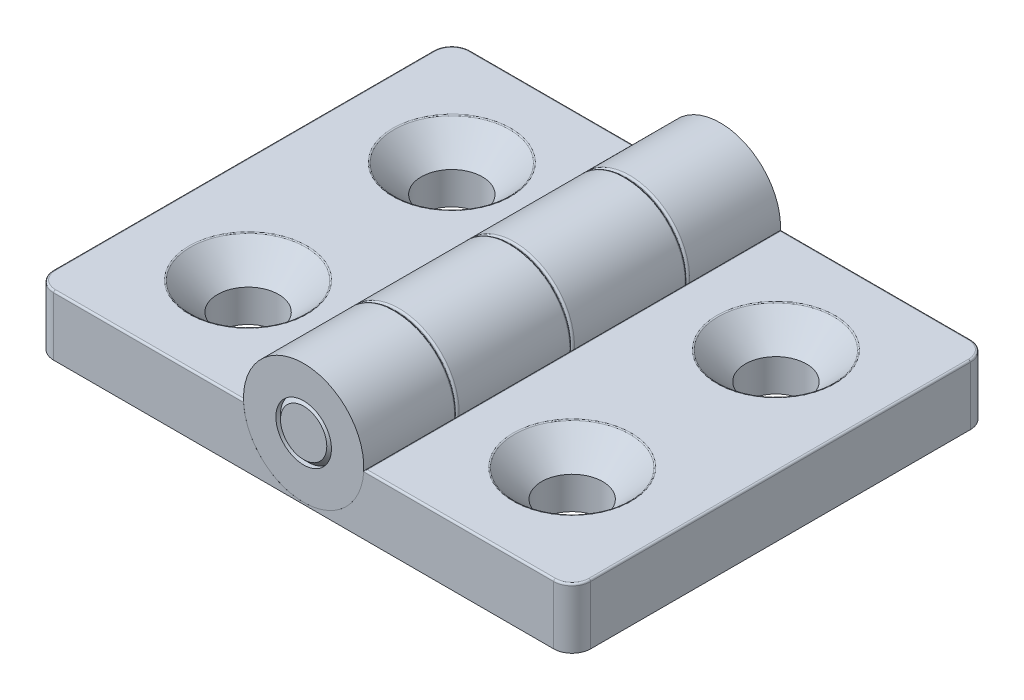
from build123d import *

# Parameters (mm, degrees)
SKETCH_1_R                  = 6.5
SKETCH_1_R_2                = 3
EXTRUDE_1_DEPTH             = 22.5
SKETCH_2_R                  = 3
EXTRUDE_2_DEPTH             = 22.5
CHAMFER_1_SIZE              = 0.5
SKETCH_3_W                  = 2.520053464
SKETCH_3_H                  = 0.1
SKETCH_3_W_2                = 2.303108133
FILLET_1_R                  = 0.2
EXTRUDE_6_DEPTH             = 45
HOLE_WIZARD_M6_1_AT_2_COUNT = 2
HOLE_WIZARD_M6_1_AT_2_PITCH = 35
HOLE_WIZARD_M6_1_AT_3_COUNT = 2
HOLE_WIZARD_M6_1_AT_3_PITCH = 22
HOLE_WIZARD_M6_1_AT_4_COUNT = 2
HOLE_WIZARD_M6_1_AT_4_PITCH = 41.340053217
FILLET_2_R                  = 0.2
FILLET_3_R                  = 2
CHAMFER_2_SIZE              = 0.5


with BuildPart() as part:
    # 草图1 → 凸台-拉伸1 (new, symmetric)
    with BuildSketch(Plane.XY):
        with Locations(Location((0, 0, 0), (0, 0, 180))):
            Circle(SKETCH_1_R)
        with Locations(Location((0, 0, 0), (0, 0, 180))):
            Circle(SKETCH_1_R_2, mode=Mode.SUBTRACT)
    extrude(amount=EXTRUDE_1_DEPTH, both=True)

    # 草图3 → 切除-旋转1 (revolve, cut)
    with BuildSketch(Plane(origin=(0, 0, 0), x_dir=(1, 0, 0), z_dir=(0, 1, 0)), mode=Mode.PRIVATE) as cut_revolve_1_sk:
        with Locations((5.937760795, 12.45)):
            Rectangle(SKETCH_3_W, SKETCH_3_H)
        with Locations((5.937760795, 0)):
            Rectangle(SKETCH_3_W, SKETCH_3_H)
        with Locations((6.04623346, -12.45)):
            Rectangle(SKETCH_3_W_2, SKETCH_3_H)
    revolve(cut_revolve_1_sk.sketch.rotate(Axis((0, 0, 22.5), (0, 0, -1)), 180), axis=Axis((0, 0, 22.5), (0, 0, -1)), mode=Mode.SUBTRACT)

    # 圆角1
    fillet_1_edges = [part.edges().sort_by_distance(p)[0] for p in [
        (6.5, 0, -12.4),
        (6.5, 0, -12.5),
        (6.5, 0, 0.05),
        (6.5, 0, -0.05),
        (6.5, 0, 12.5),
        (6.5, 0, 12.4),
    ]]
    fillet(fillet_1_edges, radius=FILLET_1_R)


with BuildPart() as body_2:
    # 草图2 → 凸台-拉伸2 (new, symmetric)
    with BuildSketch(Plane.XY):
        with Locations(Location((0, 0, 0), (0, 0, 180))):
            Circle(SKETCH_2_R)
    extrude(amount=EXTRUDE_2_DEPTH, both=True)

    # 倒角1
    chamfer_1_edges = [body_2.edges().sort_by_distance(p)[0] for p in [
        (3, 0, 22.5),
    ]]
    chamfer(chamfer_1_edges, length=CHAMFER_1_SIZE)

    # 倒角2
    chamfer_2_edges = [body_2.edges().sort_by_distance(p)[0] for p in [
        (3, 0, -22.5),
    ]]
    chamfer(chamfer_2_edges, length=CHAMFER_2_SIZE)


with BuildPart() as body_3:
    # 草图5 → 凸台-拉伸6 (new body)
    with BuildSketch(Plane(origin=(0, 0, -22.5), x_dir=(-1, 0, 0), z_dir=(0, 0, -1))):
        with BuildLine():
            Line((6.496922348, -0.2), (29, -0.2))
            Line((29, -0.2), (29, -6.7))
            Line((29, -6.7), (-29, -6.7))
            Line((-29, -6.7), (-29, -0.2))
            Line((-29, -0.2), (-6.496922348, -0.2))
            ThreePointArc((-6.496922348, -0.2), (0, -6.5), (6.496922348, -0.2))
        make_face()
    extrude(amount=-EXTRUDE_6_DEPTH)

    # 草图6 → M6 平头机械螺钉的锥形沉头孔1 (revolve, cut)
    with BuildSketch(Plane(origin=(-17.5, -0.2, -11), x_dir=(0, 0, 1), z_dir=(1, 0, 0))):
        Polygon((0, 0), (0, 6.5), (3.3, 6.5), (3.3, 3), (6.3, 0), align=None)
    hole_wizard_m6_1 = revolve(axis=Axis((-17.5, 6.15, -11), (0, -1, 0)), mode=Mode.SUBTRACT)

    # M6 平头机械螺钉的锥形沉头孔1 at 2: M6 平头机械螺钉的锥形沉头孔1 ×2
    with Locations(*[(i * HOLE_WIZARD_M6_1_AT_2_PITCH, 0, 0) for i in range(1, HOLE_WIZARD_M6_1_AT_2_COUNT)]):
        add(hole_wizard_m6_1, mode=Mode.SUBTRACT)

    # M6 平头机械螺钉的锥形沉头孔1 at 3: M6 平头机械螺钉的锥形沉头孔1 ×2
    with Locations(*[(0, 0, i * HOLE_WIZARD_M6_1_AT_3_PITCH) for i in range(1, HOLE_WIZARD_M6_1_AT_3_COUNT)]):
        add(hole_wizard_m6_1, mode=Mode.SUBTRACT)

    # M6 平头机械螺钉的锥形沉头孔1 at 4: M6 平头机械螺钉的锥形沉头孔1 ×2
    with Locations(*[Vector(0.8466365492110047, 0, 0.5321715452183459) * (i * HOLE_WIZARD_M6_1_AT_4_PITCH) for i in range(1, HOLE_WIZARD_M6_1_AT_4_COUNT)]):
        add(hole_wizard_m6_1, mode=Mode.SUBTRACT)

    # 圆角2
    fillet_2_edges = [body_3.edges().sort_by_distance(p)[0] for p in [
        (-17.748461174, -0.2, -22.5),
        (17.5, -0.2, 4.7),
        (17.748461174, -0.2, -22.5),
        (-17.5, -0.2, 4.7),
        (-29, -0.2, 0),
        (-17.748461174, -0.2, 22.5),
        (17.5, -0.2, -17.3),
        (-6.496922348, -0.2, 0),
        (6.496922348, -0.2, 0),
        (17.748461174, -0.2, 22.5),
        (29, -0.2, 0),
        (-17.5, -0.2, -17.3),
    ]]
    fillet(fillet_2_edges, radius=FILLET_2_R)

    # 圆角3
    # the kernel refuses this fillet: 2 mm, written as the material it takes off along each edge
    with BuildSketch(Plane(origin=(27, -0.2, 20.5), x_dir=(0, 0, 1), z_dir=(-1, 0, 0))) as fillet_3_piece_1:
        with BuildLine():
            CenterArc((1.8, -0.2), 0.2, 0, 90)
            Line((2, -0.2), (2, 0))
            Line((2, 0), (1.8, 0))
        make_face()
    revolve(axis=Axis((27, -0.2, 20.5), (0, 1, 0)), revolution_arc=90, mode=Mode.SUBTRACT)
    with BuildSketch(Plane(origin=(27, -0.2, -20.5), x_dir=(1, 0, 0), z_dir=(0, 0, 1))) as fillet_3_piece_2:
        with BuildLine():
            CenterArc((1.8, -0.2), 0.2, 0, 90)
            Line((2, -0.2), (2, 0))
            Line((2, 0), (1.8, 0))
        make_face()
    revolve(axis=Axis((27, -0.2, -20.5), (0, 1, 0)), revolution_arc=90, mode=Mode.SUBTRACT)
    with BuildSketch(Plane(origin=(-27, -0.2, 20.5), x_dir=(-1, 0, 0), z_dir=(0, 0, -1))) as fillet_3_piece_3:
        with BuildLine():
            CenterArc((1.8, -0.2), 0.2, 0, 90)
            Line((2, -0.2), (2, 0))
            Line((2, 0), (1.8, 0))
        make_face()
    revolve(axis=Axis((-27, -0.2, 20.5), (0, 1, 0)), revolution_arc=90, mode=Mode.SUBTRACT)
    with BuildSketch(Plane(origin=(-27, -0.2, -20.5), x_dir=(0, 0, -1), z_dir=(1, 0, 0))) as fillet_3_piece_4:
        with BuildLine():
            CenterArc((1.8, -0.2), 0.2, 0, 90)
            Line((2, -0.2), (2, 0))
            Line((2, 0), (1.8, 0))
        make_face()
    revolve(axis=Axis((-27, -0.2, -20.5), (0, 1, 0)), revolution_arc=90, mode=Mode.SUBTRACT)
    with BuildSketch(Plane(origin=(-29, -0.2, -22.5), x_dir=(1, 0, 0), z_dir=(0, -1, 0)), Plane(origin=(-29, -0.2, 22.5), x_dir=(0, 0, -1), z_dir=(0, -1, 0)), Plane(origin=(29, -11.7, -22.5), x_dir=(-1, 0, 0), z_dir=(0, 1, 0))) as fillet_3_piece_5:
        with BuildLine():
            CenterArc((FILLET_3_R, FILLET_3_R), FILLET_3_R, 180, 90)
            Line((0, FILLET_3_R), (0, 0))
            Line((0, 0), (FILLET_3_R, 0))
        make_face()
    extrude(amount=11.5, mode=Mode.SUBTRACT)
    with BuildSketch(Plane(origin=(29, -11.7, 22.5), x_dir=(-1, 0, 0), z_dir=(0, 1, 0))) as fillet_3_piece_6:
        with BuildLine():
            CenterArc((FILLET_3_R, -FILLET_3_R), FILLET_3_R, 90, 90)
            Line((0, -FILLET_3_R), (0, 0))
            Line((0, 0), (FILLET_3_R, 0))
        make_face()
    extrude(amount=11.5, mode=Mode.SUBTRACT)


solid = Compound([part.part, body_2.part, body_3.part])
